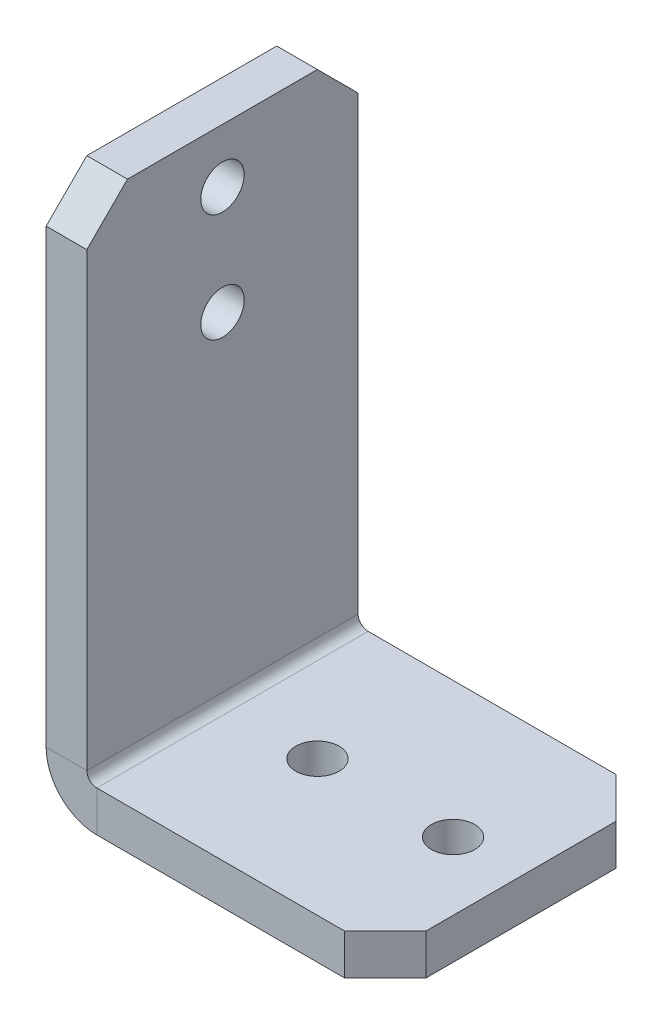
from build123d import *

# Parameters (mm, degrees)
SM_BASE_FLANGE_1_DEPTH = 20
CHAMFER_1_SIZE         = 3
SKETCH_6_R             = 1.6
CUT_EXTRUDE_1_DEPTH    = 52.23475383
PATTERN_LINEAR_1_COUNT = 2
PATTERN_LINEAR_1_PITCH = 10
SKETCH_7_R             = 1.6
CUT_EXTRUDE_2_DEPTH    = 52.23475383
PATTERN_LINEAR_2_COUNT = 2
PATTERN_LINEAR_2_PITCH = 8


# Sheet-metal steps are written as plain solids
with BuildPart() as part:
    # Sketch 1 → 基材-凸緣1 (new body)
    with BuildSketch(Plane.XY):
        with BuildLine():
            Line((0, 40), (0, 3.7366))
            ThreePointArc((0, 3.7366), (1.094424801, 1.094424801), (3.7366, 0))
            Line((3.7366, 0), (25, 0))
            Line((25, 0), (25, 3))
            Line((25, 3), (3.7366, 3))
            ThreePointArc((3.7366, 3), (3.215745145, 3.215745145), (3, 3.7366))
            Line((3, 3.7366), (3, 40))
            Line((3, 40), (0, 40))
        make_face()
    extrude(amount=SM_BASE_FLANGE_1_DEPTH)

    # 導角1
    chamfer_1_edges = [part.edges().sort_by_distance(p)[0] for p in [
        (25, 1.5, 20),
        (25, 1.5, 0),
        (1.5, 40, 20),
        (1.5, 40, 0),
    ]]
    chamfer(chamfer_1_edges, length=CHAMFER_1_SIZE)

    # 草圖6 → 除料-伸長1 (cut, through all)
    with BuildSketch(Plane.XZ):
        with Locations(Location((20, 10, 0), (0, 0, 270))):
            Circle(SKETCH_6_R)
    cut_extrude_1 = extrude(amount=-CUT_EXTRUDE_1_DEPTH, mode=Mode.SUBTRACT)

    # 直線複製排列1: 除料-伸長1 ×2
    with Locations(*[(-i * PATTERN_LINEAR_1_PITCH, 0, 0) for i in range(1, PATTERN_LINEAR_1_COUNT)]):
        add(cut_extrude_1, mode=Mode.SUBTRACT)

    # 草圖7 → 除料-伸長2 (cut, through all)
    with BuildSketch(Plane.ZY):
        with Locations((10, 36)):
            Circle(SKETCH_7_R)
    cut_extrude_2 = extrude(amount=-CUT_EXTRUDE_2_DEPTH, mode=Mode.SUBTRACT)

    # 直線複製排列2: 除料-伸長2 ×2
    with Locations(*[(0, -i * PATTERN_LINEAR_2_PITCH, 0) for i in range(1, PATTERN_LINEAR_2_COUNT)]):
        add(cut_extrude_2, mode=Mode.SUBTRACT)


solid = part.part
